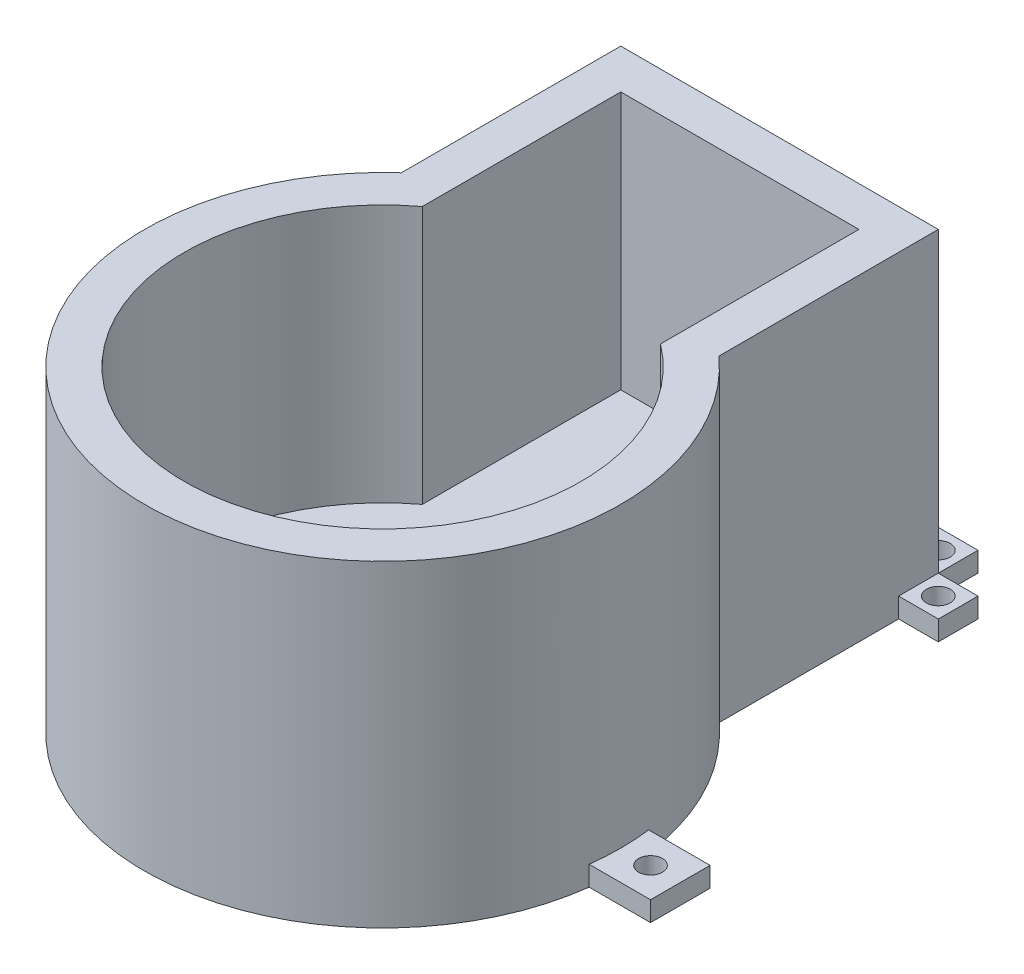
from build123d import *

# Parameters (mm, degrees)
BOSS_EXTRUDE1_DEPTH = 80
CUT_EXTRUDE1_DEPTH  = 65
SKETCH3_W           = 10
SKETCH3_H           = 10
SKETCH3_R           = 3
BOSS_EXTRUDE2_DEPTH = 5


with BuildPart() as part:
    # Sketch1 → Boss-Extrude1 (new body)
    with BuildSketch(Plane(origin=(0, 0, 0), x_dir=(1, 0, 0), z_dir=(0, 1, 0))):
        with BuildLine():
            Line((-40, -40), (-40, -15.27864045))
            ThreePointArc((-40, -15.27864045), (-24.494897428, -114.772255751), (60, -60))
            ThreePointArc((60, -60), (54.772255751, -35.505102572), (40, -15.27864045))
            Line((40, -15.27864045), (40, -40))
            Line((40, -40), (-40, -40))
        make_face()
        with BuildLine():
            ThreePointArc((40, -15.27864045), (0, 0), (-40, -15.27864045))
            Line((-40, -15.27864045), (-40, -40))
            Line((-40, -40), (40, -40))
            Line((40, -40), (40, -15.27864045))
        make_face()
        with BuildLine():
            Line((40, 40), (-40, 40))
            Line((-40, 40), (-40, -15.27864045))
            ThreePointArc((-40, -15.27864045), (0, 0), (40, -15.27864045))
            Line((40, -15.27864045), (40, 40))
        make_face()
        with BuildLine():
            Line((40, 40), (-40, 40))
            Line((-40, 40), (-40, -15.27864045))
            ThreePointArc((-40, -15.27864045), (0, 0), (40, -15.27864045))
            Line((40, -15.27864045), (40, 40))
        make_face()
        with BuildLine():
            Line((40, 40), (-40, 40))
            Line((-40, 40), (-40, -15.27864045))
            ThreePointArc((-40, -15.27864045), (0, 0), (40, -15.27864045))
            Line((40, -15.27864045), (40, 40))
        make_face()
        with BuildLine():
            ThreePointArc((40, -15.27864045), (0, 0), (-40, -15.27864045))
            Line((-40, -15.27864045), (-40, -40))
            Line((-40, -40), (40, -40))
            Line((40, -40), (40, -15.27864045))
        make_face()
        with BuildLine():
            ThreePointArc((40, -15.27864045), (0, 0), (-40, -15.27864045))
            Line((-40, -15.27864045), (-40, -40))
            Line((-40, -40), (40, -40))
            Line((40, -40), (40, -15.27864045))
        make_face()
        with BuildLine():
            Line((-40, -40), (-40, -15.27864045))
            ThreePointArc((-40, -15.27864045), (-24.494897428, -114.772255751), (60, -60))
            ThreePointArc((60, -60), (54.772255751, -35.505102572), (40, -15.27864045))
            Line((40, -15.27864045), (40, -40))
            Line((40, -40), (-40, -40))
        make_face()
        with BuildLine():
            ThreePointArc((40, -15.27864045), (0, 0), (-40, -15.27864045))
            Line((-40, -15.27864045), (-40, -40))
            Line((-40, -40), (40, -40))
            Line((40, -40), (40, -15.27864045))
        make_face()
    extrude(amount=BOSS_EXTRUDE1_DEPTH)

    # Sketch2 → Cut-Extrude1 (cut)
    with BuildSketch(Plane(origin=(0, 80, 0), x_dir=(1, 0, 0), z_dir=(0, 1, 0))):
        with BuildLine():
            Line((30, 30), (-30, 30))
            Line((-30, 30), (-30, -20))
            ThreePointArc((-30, -20), (0, -110), (30, -20))
            Line((30, -20), (30, 30))
        make_face()
    extrude(amount=-CUT_EXTRUDE1_DEPTH, mode=Mode.SUBTRACT)

    # Sketch3 → Boss-Extrude2 (add)
    # profile 1 of 6: a face of its own
    with BuildSketch(Plane.XZ):
        with Locations((45, -35)):
            Rectangle(SKETCH3_W, SKETCH3_H)
        with Locations((45, -35)):
            Circle(SKETCH3_R, mode=Mode.SUBTRACT)
    # profile 2 of 6: a face of its own
    with BuildSketch(Plane.XZ):
        with Locations((35, -45)):
            Rectangle(SKETCH3_W, SKETCH3_H)
        with Locations((35, -45)):
            Circle(SKETCH3_R, mode=Mode.SUBTRACT)
    # profile 3 of 6: a face of its own
    with BuildSketch(Plane.XZ):
        with Locations((-35, -45)):
            Rectangle(SKETCH3_W, SKETCH3_H)
        with Locations((-35, -45)):
            Circle(SKETCH3_R, mode=Mode.SUBTRACT)
    # profile 4 of 6: a face of its own
    with BuildSketch(Plane.XZ):
        with BuildLine():
            ThreePointArc((59.529404499, 67.5), (60, 60), (59.529404499, 52.5))
            Line((59.529404499, 52.5), (75, 52.5))
            Line((75, 52.5), (75, 67.5))
            Line((75, 67.5), (59.529404499, 67.5))
        make_face()
        with Locations((67.5, 60)):
            Circle(SKETCH3_R, mode=Mode.SUBTRACT)
    # profile 5 of 6: a face of its own
    with BuildSketch(Plane.XZ):
        with Locations((-45, -35)):
            Rectangle(SKETCH3_W, SKETCH3_H)
        with Locations((-45, -35)):
            Circle(SKETCH3_R, mode=Mode.SUBTRACT)
    # profile 6 of 6: a face of its own
    with BuildSketch(Plane.XZ):
        with BuildLine():
            Line((-75, 52.5), (-59.529404499, 52.5))
            ThreePointArc((-59.529404499, 52.5), (-60, 60), (-59.529404499, 67.5))
            Line((-59.529404499, 67.5), (-75, 67.5))
            Line((-75, 67.5), (-75, 52.5))
        make_face()
        with Locations((-67.5, 60)):
            Circle(SKETCH3_R, mode=Mode.SUBTRACT)
    extrude(amount=-BOSS_EXTRUDE2_DEPTH)


solid = part.part
